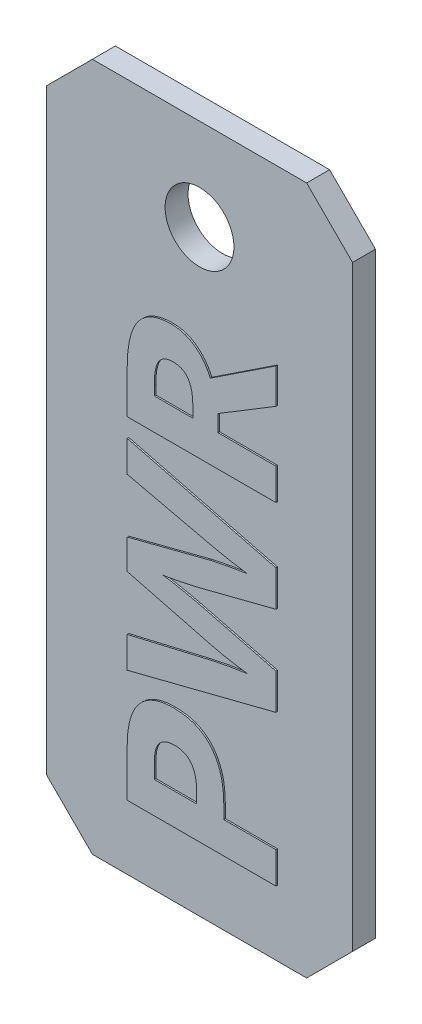
from build123d import *

# Parameters (mm, degrees)
SKETCH1_R      = 2.25
BASE_DEPTH     = 0.75
TEXT_PWR_DEPTH = 0.1


# Read off the part's stored shape, not the designer's step: Text-PWR
with BuildPart() as part:
    # Sketch1 → Base (new, symmetric)
    with BuildSketch(Plane.XY):
        Polygon((-7, 22.5), (-10, 19.5), (-10, -19.5), (-7, -22.5), (7, -22.5), (10, -19.5), (10, 19.5), (7, 22.5), align=None)
        with Locations((0, 16.5)):
            Circle(SKETCH1_R, mode=Mode.SUBTRACT)
    extrude(amount=BASE_DEPTH, both=True)

    # Text-PWR outline → Text-PWR (add)
    # profile 1 of 3: a face of its own
    with BuildSketch(Plane.XY.offset(0.75)):
        with BuildLine():
            add(Edge.make_bspline(
                [(-4.62523569, -15.081722549), (-4.623037253, -14.937713298), (-4.618773776, -14.658432978), (-4.583909016, -14.25302388), (-4.52196753, -13.875157703), (-4.44098864, -13.522230063), (-4.332417941, -13.196195715), (-4.200635889, -12.896507559), (-4.043855059, -12.624162876), (-3.864121829, -12.378102022), (-3.66029729, -12.15931758), (-3.431012458, -11.9707207), (-3.179132756, -11.809746871), (-2.902727224, -11.679111664), (-2.602558457, -11.579091532), (-2.279655863, -11.50631108), (-1.932910991, -11.462412754), (-1.693895738, -11.457852884), (-1.570852761, -11.455505502)],
                knots=[0, 0, 0, 0, 0.079760974, 0.154682218, 0.225129286, 0.291713071, 0.355033827, 0.415176838, 0.472752674, 0.528749477, 0.583612838, 0.637918912, 0.692759316, 0.748779785, 0.80680508, 0.867657949, 0.931871462, 1, 1, 1, 1], degree=3))
            Line((-4.62523569, -15.081722549), (-4.62523569, -18.201176257))
            Line((-4.62523569, -18.201176257), (5.092000638, -18.201176257))
            Line((5.092000638, -18.201176257), (5.092000638, -16.138629747))
            Line((5.092000638, -16.138629747), (1.68465803, -16.138629747))
            Line((1.68465803, -16.138629747), (1.68465803, -15.249329101))
            add(Edge.make_bspline(
                [(-1.570852761, -11.455505502), (-1.442547008, -11.45850851), (-1.193638219, -11.464334243), (-0.831670399, -11.510116734), (-0.49265253, -11.586690397), (-0.175777458, -11.694150637), (0.116486809, -11.836234923), (0.387130712, -12.005774531), (0.63255258, -12.208889626), (0.855112287, -12.440519), (1.049311099, -12.702192867), (1.220806656, -12.988407568), (1.364507581, -13.302075902), (1.482455707, -13.641461244), (1.572854612, -14.007282721), (1.63684214, -14.398292034), (1.676885054, -14.815352699), (1.682019298, -15.102004947), (1.68465803, -15.249329101)],
                knots=[0, 0, 0, 0, 0.067641603, 0.131222404, 0.192010899, 0.250649939, 0.307229909, 0.362999428, 0.418648197, 0.47478376, 0.531970857, 0.590102742, 0.650426064, 0.713562269, 0.779297228, 0.848868334, 0.922326285, 1, 1, 1, 1], degree=3))
        make_face()
        with BuildLine():
            add(Edge.make_bspline(
                [(-0.082112212, -15.454400647), (-0.08341634, -15.376824828), (-0.085938998, -15.226764992), (-0.100523735, -15.008571544), (-0.130692292, -14.805897506), (-0.169829068, -14.618152901), (-0.218045071, -14.444487342), (-0.281754187, -14.287293964), (-0.354068412, -14.143699358), (-0.439791643, -14.016067348), (-0.536407781, -13.904277778), (-0.641544015, -13.805067187), (-0.760389236, -13.72450969), (-0.886987447, -13.654685811), (-1.025655522, -13.603999505), (-1.172736503, -13.565659644), (-1.33099852, -13.544592693), (-1.439996941, -13.54138705), (-1.495922773, -13.539742272)],
                knots=[0, 0, 0, 0, 0.08595616, 0.166270463, 0.242066955, 0.31276304, 0.378680835, 0.441425047, 0.50037382, 0.556521345, 0.611258083, 0.663820285, 0.716139797, 0.769899015, 0.823594078, 0.879229263, 0.938033929, 1, 1, 1, 1], degree=3))
            Line((-0.082112212, -15.454400647), (-0.082112212, -16.138629747))
            Line((-0.082112212, -16.138629747), (-2.858465449, -16.138629747))
            Line((-2.858465449, -16.138629747), (-2.858465449, -15.19214569))
            add(Edge.make_bspline(
                [(-1.495922773, -13.539742272), (-1.55252065, -13.540574897), (-1.661492616, -13.542178011), (-1.819097653, -13.562972487), (-1.965679952, -13.594120491), (-2.101428698, -13.636840981), (-2.225920003, -13.692010043), (-2.336857758, -13.762510144), (-2.439032726, -13.842983816), (-2.527482783, -13.939379168), (-2.607724621, -14.046199196), (-2.674929464, -14.168676205), (-2.731456707, -14.305089547), (-2.779166328, -14.45534246), (-2.813679047, -14.61995443), (-2.839070037, -14.797794795), (-2.854975064, -14.990077354), (-2.857272794, -15.12309951), (-2.858465449, -15.19214569)],
                knots=[0, 0, 0, 0, 0.068900677, 0.132659432, 0.193279169, 0.251266578, 0.30573661, 0.358612051, 0.41100638, 0.46368747, 0.517494364, 0.573410523, 0.633338899, 0.697152934, 0.765154501, 0.837963901, 0.91589391, 1, 1, 1, 1], degree=3))
        make_face(mode=Mode.SUBTRACT)
    # profile 2 of 3: a face of its own
    with BuildSketch(Plane.XY.offset(0.75)):
        with BuildLine():
            add(Edge.make_bspline(
                [(3.222694624, -1.458267641), (3.130593126, -1.44633526), (2.936142534, -1.421142853), (2.629726268, -1.369437106), (2.290913417, -1.313437179), (1.931438005, -1.247873741), (1.57372426, -1.179513191), (1.241870576, -1.110646324), (0.946682499, -1.045726994), (0.76309191, -1.001711201), (0.677046876, -0.981081928)],
                knots=[0, 0, 0, 0, 0.107520595, 0.227004381, 0.359748657, 0.505142811, 0.650068159, 0.78141106, 0.897551979, 1, 1, 1, 1], degree=3))
            add(Edge.make_bspline(
                [(0.817047643, -1.899960201), (0.886003997, -1.883281103), (1.039293383, -1.84620361), (1.294242705, -1.790939593), (1.597889878, -1.733627578), (1.936604193, -1.66748774), (2.286535542, -1.605731364), (2.622081408, -1.547101808), (2.931411639, -1.500906819), (3.128698111, -1.472027229), (3.222694624, -1.458267641)],
                knots=[0, 0, 0, 0, 0.086988292, 0.193374232, 0.319820665, 0.465869944, 0.616527307, 0.75551477, 0.883515789, 1, 1, 1, 1], degree=3))
            Line((0.817047643, -1.899960201), (-4.62523569, -3.305883395))
            Line((-4.62523569, -3.305883395), (-4.62523569, -5.254063081))
            Line((-4.62523569, -5.254063081), (0.817047643, -6.659986276))
            add(Edge.make_bspline(
                [(3.222694624, -7.107594361), (3.150995055, -7.099474752), (2.989509625, -7.081187353), (2.722274655, -7.04000316), (2.402577454, -6.989566182), (2.047973609, -6.925790468), (1.688335972, -6.86186592), (1.358175945, -6.791691243), (1.071509595, -6.728711035), (0.897091472, -6.681604411), (0.817047643, -6.659986276)],
                knots=[0, 0, 0, 0, 0.08839637, 0.199090821, 0.331213824, 0.484918959, 0.64049432, 0.778684183, 0.898433918, 1, 1, 1, 1], degree=3))
            add(Edge.make_bspline(
                [(0.677046876, -7.576892707), (0.913557968, -7.526428261), (1.369548862, -7.429133342), (2.030105915, -7.296802535), (2.642704399, -7.193085169), (3.03527285, -7.135220411), (3.222694624, -7.107594361)],
                knots=[0, 0, 0, 0, 0.280206636, 0.540235444, 0.780497163, 1, 1, 1, 1], degree=3))
            Line((0.677046876, -7.576892707), (-4.62523569, -8.815209349))
            Line((-4.62523569, -8.815209349), (-4.62523569, -10.844234548))
            Line((-4.62523569, -10.844234548), (5.092000638, -8.371544947))
            Line((5.092000638, -8.371544947), (5.092000638, -6.028996904))
            Line((5.092000638, -6.028996904), (0.002676985, -4.731525008))
            add(Edge.make_bspline(
                [(-2.282687647, -4.289832447), (-2.213626127, -4.29870033), (-2.057423744, -4.318757585), (-1.796420648, -4.361033476), (-1.481199697, -4.419218967), (-1.129364733, -4.486037606), (-0.779948218, -4.55771952), (-0.468234255, -4.622704835), (-0.213750072, -4.678869177), (-0.063003011, -4.715545329), (0.002676985, -4.731525008)],
                knots=[0, 0, 0, 0, 0.089702147, 0.202887068, 0.340584549, 0.502677747, 0.664268048, 0.800122682, 0.912914113, 1, 1, 1, 1], degree=3))
            add(Edge.make_bspline(
                [(-0.011125908, -3.84025252), (-0.036759117, -3.846825914), (-0.093892808, -3.861477309), (-0.188887477, -3.885818557), (-0.303009439, -3.910368447), (-0.435074865, -3.940137845), (-0.584685473, -3.974158774), (-0.752622678, -4.008777398), (-0.938273213, -4.049279153), (-1.137082757, -4.088538177), (-1.336188501, -4.128865709), (-1.523259103, -4.166998342), (-1.693057379, -4.198098209), (-1.844903063, -4.225589346), (-1.97874278, -4.250152698), (-2.095942717, -4.267310556), (-2.195025671, -4.282056352), (-2.255711674, -4.287439531), (-2.282687647, -4.289832447)],
                knots=[0, 0, 0, 0, 0.034267352, 0.076378273, 0.126967827, 0.185404276, 0.251687624, 0.325636869, 0.407432668, 0.497735291, 0.588037914, 0.670495251, 0.744947276, 0.811557682, 0.87032788, 0.921124638, 0.964938543, 1, 1, 1, 1], degree=3))
            Line((-0.011125908, -3.84025252), (5.092000638, -2.534893256))
            Line((5.092000638, -2.534893256), (5.092000638, -0.186429688))
            Line((5.092000638, -0.186429688), (-4.62523569, 2.280344388))
            Line((-4.62523569, 2.280344388), (-4.62523569, 0.249347347))
            Line((-4.62523569, 0.249347347), (0.677046876, -0.981081928))
        make_face()
    # profile 3 of 3: a face of its own
    with BuildSketch(Plane.XY.offset(0.75)):
        with BuildLine():
            add(Edge.make_bspline(
                [(0.805216592, 8.402913138), (0.940663929, 8.491573635), (1.205150554, 8.664700078), (1.591931265, 8.919612126), (1.960609974, 9.162233017), (2.31147336, 9.392129945), (2.643059547, 9.612518471), (2.95799201, 9.817425401), (3.252389399, 10.0147242), (3.530065673, 10.196653003), (3.788531253, 10.368963128), (4.029236273, 10.528470596), (4.251033336, 10.676250064), (4.455692968, 10.810291635), (4.640342658, 10.93491655), (4.807826811, 11.046517739), (4.955974001, 11.147672744), (5.048616536, 11.210821281), (5.092000638, 11.24039347)],
                knots=[0, 0, 0, 0, 0.094469554, 0.184469728, 0.270321107, 0.352023698, 0.429257201, 0.502662244, 0.571278283, 0.636065297, 0.696383604, 0.752553045, 0.804573623, 0.851913792, 0.895317504, 0.934572358, 0.969360516, 1, 1, 1, 1], degree=3))
            add(Edge.make_bspline(
                [(-1.742402997, 10.195317323), (-1.672674162, 10.193680203), (-1.534199451, 10.19042904), (-1.329934472, 10.16821181), (-1.131253793, 10.133329767), (-0.938779685, 10.081386453), (-0.752140889, 10.014785326), (-0.571460993, 9.932512258), (-0.395477663, 9.839138066), (-0.228744065, 9.727523277), (-0.067644434, 9.605509452), (0.082929337, 9.468619046), (0.228597597, 9.323042455), (0.362231059, 9.162710088), (0.486438852, 8.990159212), (0.60376665, 8.806593842), (0.709324973, 8.609323138), (0.773008224, 8.472242756), (0.805216592, 8.402913138)],
                knots=[0, 0, 0, 0, 0.063181295, 0.125471931, 0.185991755, 0.245806962, 0.305906188, 0.365355513, 0.425584467, 0.486212642, 0.546969415, 0.608552652, 0.670466251, 0.733459158, 0.797438376, 0.863038409, 0.930730461, 1, 1, 1, 1], degree=3))
            add(Edge.make_bspline(
                [(-4.62523569, 6.326563736), (-4.62295928, 6.485686632), (-4.618551614, 6.793785942), (-4.584972963, 7.239500165), (-4.530250402, 7.653749303), (-4.454871205, 8.036433122), (-4.355450002, 8.38738539), (-4.229496995, 8.70446118), (-4.087901239, 8.99295999), (-3.917858139, 9.24724668), (-3.728609434, 9.47307956), (-3.51237041, 9.665856683), (-3.2743979, 9.830902286), (-3.012621419, 9.965703362), (-2.727091289, 10.067622915), (-2.420098673, 10.1432777), (-2.088660021, 10.185816186), (-1.860174162, 10.192085735), (-1.742402997, 10.195317323)],
                knots=[0, 0, 0, 0, 0.086553591, 0.167588085, 0.242983585, 0.313735954, 0.379596938, 0.441079874, 0.49912417, 0.554062453, 0.607077544, 0.658981381, 0.711150549, 0.764241546, 0.818646684, 0.875708058, 0.935934736, 1, 1, 1, 1], degree=3))
            Line((-4.62523569, 6.326563736), (-4.62523569, 3.504858138))
            Line((-4.62523569, 3.504858138), (5.092000638, 3.504858138))
            Line((5.092000638, 3.504858138), (5.092000638, 5.567404648))
            Line((5.092000638, 5.567404648), (1.306064406, 5.567404648))
            Line((1.306064406, 5.567404648), (1.306064406, 6.651917631))
            Line((1.306064406, 6.651917631), (5.092000638, 8.951085155))
            Line((5.092000638, 8.951085155), (5.092000638, 11.24039347))
        make_face()
        with BuildLine():
            add(Edge.make_bspline(
                [(-0.334507961, 6.224027963), (-0.334821113, 6.301627206), (-0.335429563, 6.452401176), (-0.352731778, 6.670047265), (-0.37454416, 6.87320266), (-0.410693278, 7.059306431), (-0.453322856, 7.230318539), (-0.506313099, 7.385891429), (-0.571119463, 7.524956368), (-0.644603271, 7.650059796), (-0.729375415, 7.758902447), (-0.826045314, 7.853064971), (-0.932073418, 7.934204918), (-1.050081101, 8.000375978), (-1.179943295, 8.049315892), (-1.320874751, 8.084576823), (-1.472904003, 8.10641144), (-1.578008844, 8.109496424), (-1.631979857, 8.111080554)],
                knots=[0, 0, 0, 0, 0.08902455, 0.172973142, 0.250446159, 0.323383175, 0.39034519, 0.452608844, 0.511669144, 0.566133111, 0.618796423, 0.669471927, 0.720616866, 0.771611386, 0.824144879, 0.879397167, 0.938070816, 1, 1, 1, 1], degree=3))
            Line((-0.334507961, 6.224027963), (-0.334507961, 5.567404648))
            Line((-0.334507961, 5.567404648), (-2.858465449, 5.567404648))
            Line((-2.858465449, 5.567404648), (-2.858465449, 6.184591127))
            add(Edge.make_bspline(
                [(-1.631979857, 8.111080554), (-1.685286423, 8.109476828), (-1.788418251, 8.106374112), (-1.937499296, 8.085089764), (-2.074402385, 8.047364937), (-2.199795305, 7.996072654), (-2.313839792, 7.930593554), (-2.415719043, 7.849433051), (-2.502471642, 7.750457995), (-2.580505328, 7.639000045), (-2.646763153, 7.51202957), (-2.704848515, 7.370294999), (-2.750820846, 7.211986582), (-2.790291657, 7.037502359), (-2.821671509, 6.847252348), (-2.842426252, 6.640449461), (-2.856977931, 6.418134237), (-2.857958723, 6.264148068), (-2.858465449, 6.184591127)],
                knots=[0, 0, 0, 0, 0.061341869, 0.118677672, 0.172810769, 0.224361633, 0.274179813, 0.323675393, 0.373487831, 0.42510524, 0.479921001, 0.537931366, 0.601106522, 0.669365843, 0.743726637, 0.822829498, 0.908464876, 1, 1, 1, 1], degree=3))
        make_face(mode=Mode.SUBTRACT)
    extrude(amount=TEXT_PWR_DEPTH)


solid = part.part
